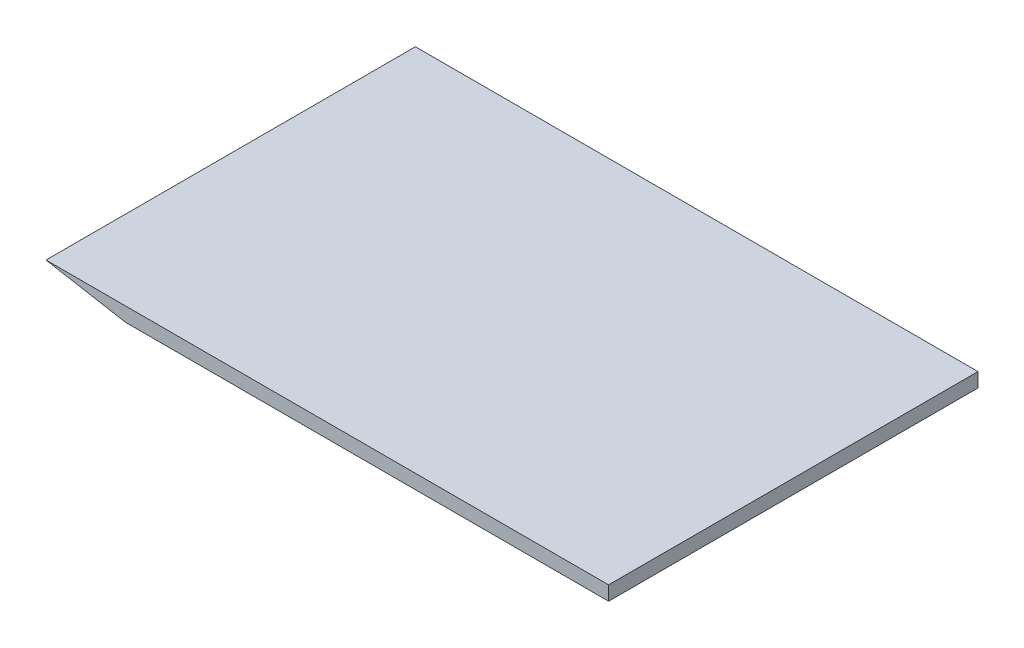
from build123d import *

# Parameters (mm, degrees)
BOSS_EXTRUDE1_DEPTH = 130


with BuildPart() as part:
    # Sketch1 → Boss-Extrude1 (new body)
    with BuildSketch(Plane.XY):
        Polygon((0, 0), (198, 0), (198, -5), (28, -5), align=None)
    extrude(amount=BOSS_EXTRUDE1_DEPTH)


solid = part.part
